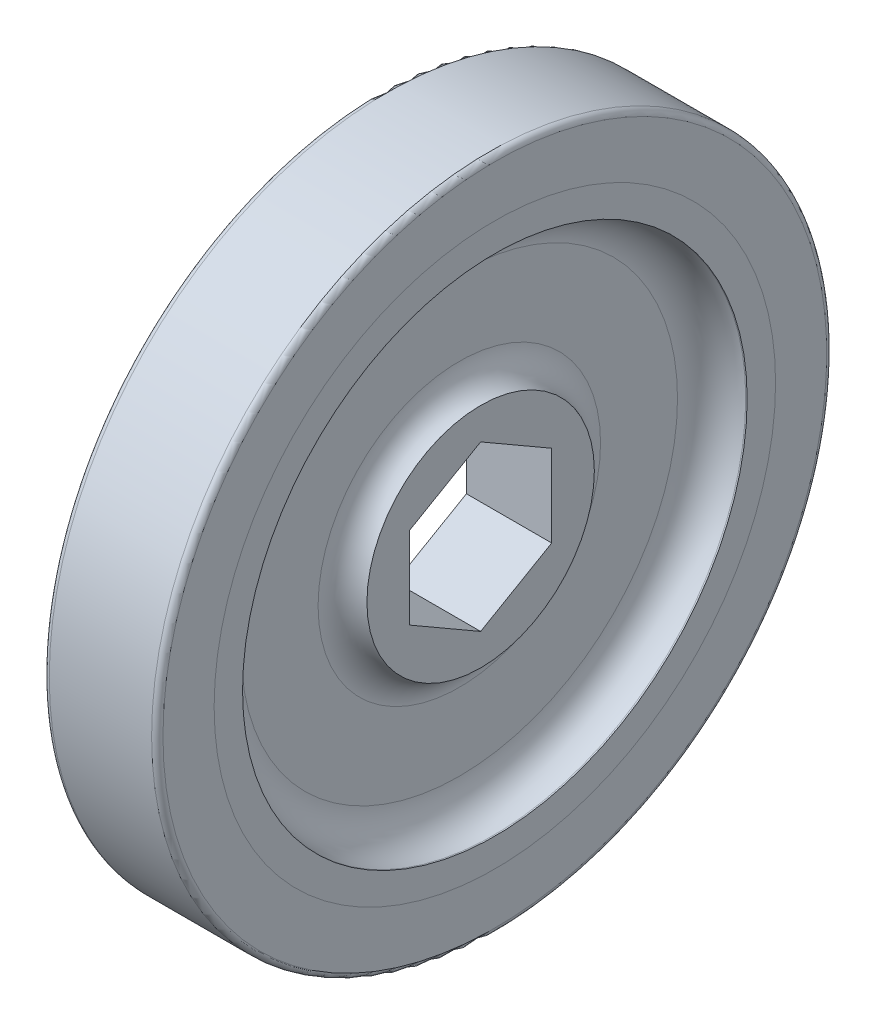
from build123d import *

# Parameters (mm, degrees)
CONG_1_R            = 2.54
CONG_2_R            = 3.048
HEX_HOLE_DEPTH      = 40.393037615
HEX_HOLE_DEPTH_BACK = 40.393037615
CONG_3_R            = 0.508


with BuildPart() as part:
    # Esquisse1 → Révolution1 (revolve)
    with BuildSketch(Plane.XY, mode=Mode.PRIVATE) as r_volution1_sk:
        Polygon((1.905, 10.16), (3.81, 10.16), (3.81, 0), (-3.81, 0), (-3.81, 10.16), (-1.905, 10.16), (-1.905, 22.5425), (-5.08, 22.5425), (-5.08, 25.0825), (-2.54, 25.0825), (-2.54, 27.6225), (2.54, 27.6225), (2.54, 25.0825), (5.08, 25.0825), (5.08, 22.5425), (1.905, 22.5425), align=None)
    revolve(r_volution1_sk.sketch.rotate(Axis((-3.81, 0, 0), (1, 0, 0)), 90), axis=Axis((-3.81, 0, 0), (1, 0, 0)))

    # Congé1
    # the kernel refuses this fillet: 2.54 mm, written as the material it adds along each edge
    with BuildSketch(Plane(origin=(-1.905, 0, 0), x_dir=(0, 0, 1), z_dir=(0, 1, 0))) as cong_1_piece_1:
        with BuildLine():
            CenterArc((12.619344425, -2.54), CONG_1_R, 90, 75.522487814)
            Line((12.619344425, 0), (12.619344425, 0.0508))
            Line((12.619344425, 0.0508), (10.16, 0.0508))
            Line((10.16, 0.0508), (10.1092, 0))
            ThreePointArc((10.1092, 0), (10.1092, -0.9525), (10.110813112, -1.8923))
            Line((10.110813112, -1.8923), (10.16, -1.905))
        make_face()
    revolve(axis=Axis((-1.905, 0, 0), (1, 0, 0)))
    with BuildSketch(Plane(origin=(1.905, 0, 0), x_dir=(0, 0, 1), z_dir=(0, 1, 0))) as cong_1_piece_2:
        with BuildLine():
            CenterArc((12.619344425, 2.54), CONG_1_R, 194.477512186, 75.522487814)
            Line((12.619344425, 0), (12.619344425, -0.0508))
            Line((12.619344425, -0.0508), (10.16, -0.0508))
            Line((10.16, -0.0508), (10.1092, 0))
            ThreePointArc((10.1092, 0), (10.1092, 0.9525), (10.110813112, 1.8923))
            Line((10.110813112, 1.8923), (10.16, 1.905))
        make_face()
    revolve(axis=Axis((1.905, 0, 0), (1, 0, 0)))

    # Congé2
    cong_2_edges = [part.edges().sort_by_distance(p)[0] for p in [
        (-1.905, 0, -22.5425),
        (1.905, 0, -22.5425),
    ]]
    fillet(cong_2_edges, radius=CONG_2_R)

    # Esquisse3 → hex_hole (cut, two sides: drawn at the far end of the back side and taken through both)
    with BuildSketch(Plane(origin=(0, 0, 0), x_dir=(0, 0, -1), z_dir=(1, 0, 0)).offset(-HEX_HOLE_DEPTH_BACK)):
        Polygon((0, 7.332348419), (-6.35, 3.666174209), (-6.35, -3.666174209), (0, -7.332348419), (6.35, -3.666174209), (6.35, 3.666174209), align=None)
    extrude(amount=HEX_HOLE_DEPTH + HEX_HOLE_DEPTH_BACK, mode=Mode.SUBTRACT)


with BuildPart() as body_2:
    # Esquisse2 → Révolution2 (revolve)
    with BuildSketch(Plane.XY, mode=Mode.PRIVATE) as r_volution2_sk:
        Polygon((-5.08, 25.0825), (-2.54, 25.0825), (-2.54, 27.6225), (2.54, 27.6225), (2.54, 25.0825), (5.08, 25.0825), (5.08, 30.1625), (-5.08, 30.1625), align=None)
    revolve(r_volution2_sk.sketch.rotate(Axis((-3.81, 0, 0), (1, 0, 0)), 270), axis=Axis((-3.81, 0, 0), (1, 0, 0)))

    # Congé3
    cong_3_edges = [body_2.edges().sort_by_distance(p)[0] for p in [
        (-5.08, 0, 30.1625),
        (5.08, 0, 30.1625),
    ]]
    fillet(cong_3_edges, radius=CONG_3_R)


solid = Compound([part.part, body_2.part])
